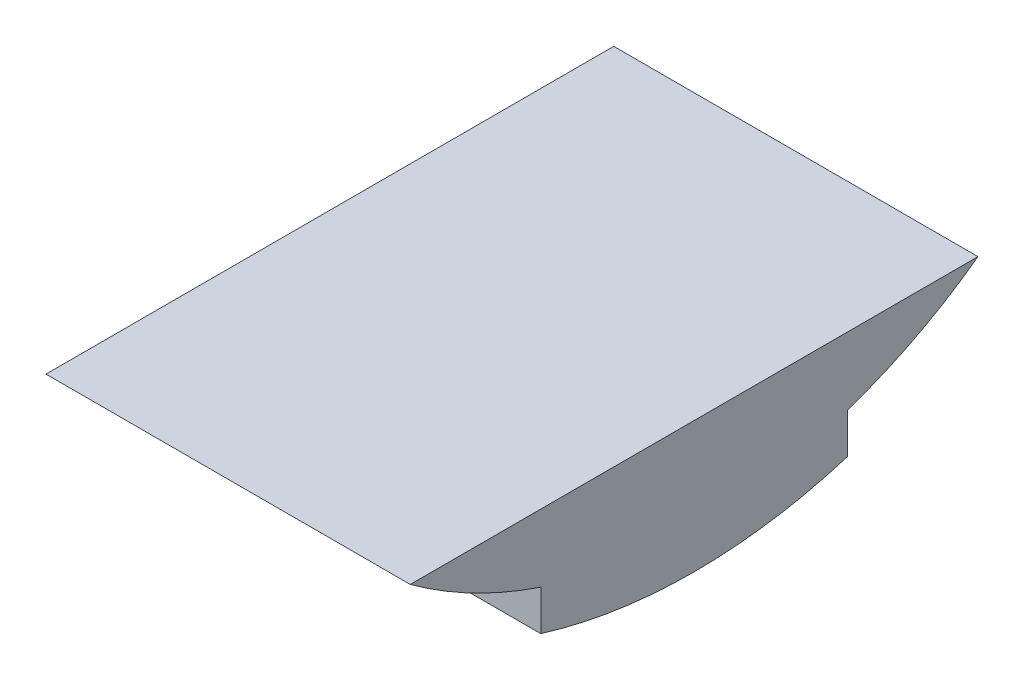
from build123d import *

# Parameters (mm, degrees)
SKETCH1_W           = 200
SKETCH1_H           = 200
BOSS_EXTRUDE1_DEPTH = 340
CAVITY1_START       = -100
CAVITY1_DEPTH       = 200
CAVITY1_START_2     = 91.703376511
CAVITY1_2_DEPTH     = 8.296623489
CAVITY1_3_DEPTH     = 1.703376511


# Read off the part's stored shape, not the designer's step: Cavity1
with BuildPart() as part:
    # Sketch1 → Boss-Extrude1 (new body)
    with BuildSketch(Plane.XY):
        Rectangle(SKETCH1_W, SKETCH1_H)
    extrude(amount=BOSS_EXTRUDE1_DEPTH)

    # Cavity1 outline → Cavity1 (cut)
    with BuildSketch(Plane.YZ.offset(CAVITY1_START)):
        with BuildLine():
            ThreePointArc((100, 19.737266788), (79.748929914, 52.418363447), (64.730256288, 87.81044393))
            Line((64.730256288, 87.81044393), (43.715736742, 87.81044393))
            ThreePointArc((43.715736742, 87.81044393), (31.630726001, 167.81044393), (43.715736742, 247.81044393))
            Line((43.715736742, 247.81044393), (64.730256288, 247.81044393))
            ThreePointArc((64.730256288, 247.81044393), (79.748929914, 283.202524413), (100, 315.883621072))
            Line((100, 315.883621072), (100, 340))
            Line((100, 340), (-100, 340))
            Line((-100, 340), (-100, 0))
            Line((-100, 0), (100, 0))
            Line((100, 0), (100, 19.737266788))
        make_face()
    extrude(amount=CAVITY1_DEPTH, mode=Mode.SUBTRACT)

    # Cavity1 2 outline → Cavity1 2 (cut)
    with BuildSketch(Plane.YZ.offset(CAVITY1_START_2)):
        with BuildLine():
            Line((43.715736742, 87.81044393), (64.730256288, 87.81044393))
            ThreePointArc((64.730256288, 87.81044393), (79.748929914, 52.418363447), (100, 19.737266788))
            Line((100, 19.737266788), (100, 315.883621072))
            ThreePointArc((100, 315.883621072), (79.748929914, 283.202524413), (64.730256288, 247.81044393))
            Line((64.730256288, 247.81044393), (43.715736742, 247.81044393))
            ThreePointArc((43.715736742, 247.81044393), (31.630726001, 167.81044393), (43.715736742, 87.81044393))
        make_face()
    extrude(amount=CAVITY1_2_DEPTH, mode=Mode.SUBTRACT)

    # Cavity1 3 outline → Cavity1 3 (cut)
    with BuildSketch(Plane.YZ.offset(CAVITY1_START)):
        with BuildLine():
            Line((43.715736742, 87.81044393), (64.730256288, 87.81044393))
            ThreePointArc((64.730256288, 87.81044393), (79.748929914, 52.418363447), (100, 19.737266788))
            Line((100, 19.737266788), (100, 315.883621072))
            ThreePointArc((100, 315.883621072), (79.748929914, 283.202524413), (64.730256288, 247.81044393))
            Line((64.730256288, 247.81044393), (43.715736742, 247.81044393))
            ThreePointArc((43.715736742, 247.81044393), (31.630726001, 167.81044393), (43.715736742, 87.81044393))
        make_face()
    extrude(amount=CAVITY1_3_DEPTH, mode=Mode.SUBTRACT)


solid = part.part
